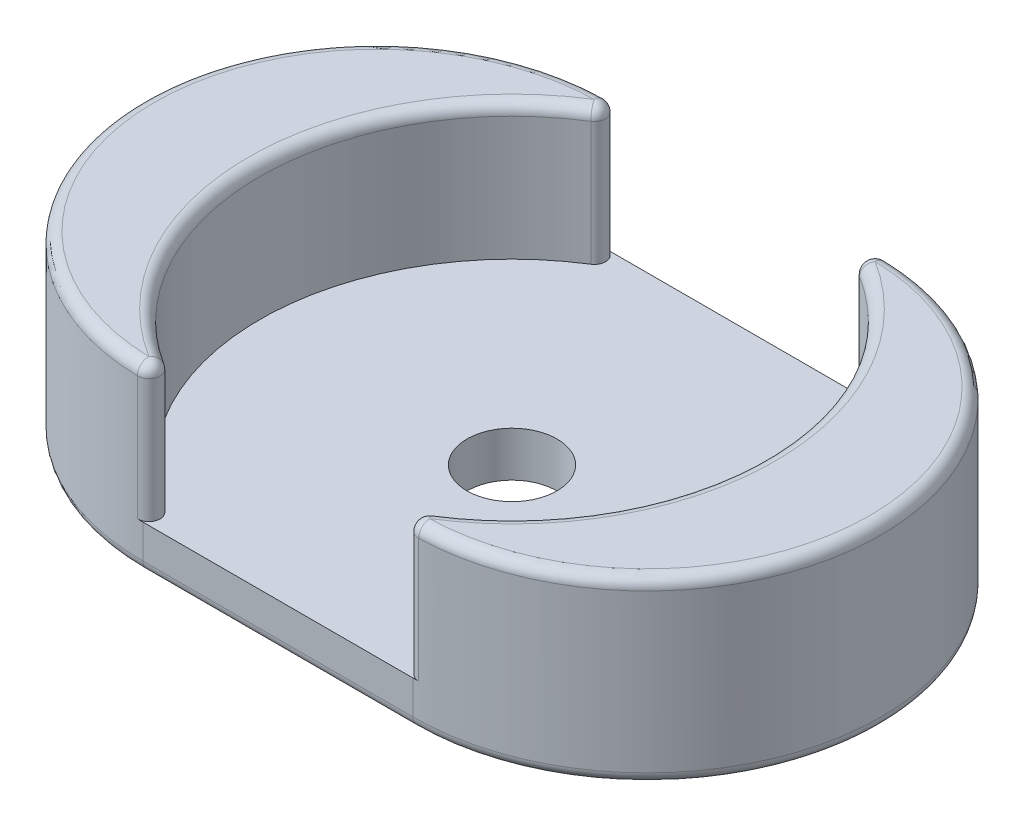
from build123d import *

# Parameters (mm, degrees)
BOSS_EXTRUDE1_DEPTH   = 2
BOSS_EXTRUDE1_2_DEPTH = 2
BOSS_EXTRUDE2_DEPTH   = 0.5
HOLE2_OUTLINE_R       = 0.5
HOLE2_DEPTH           = 0.5
FILLET2_R             = 0.125
FILLET3_R             = 0.125


# Read off the part's stored shape, not the designer's step: Hole2
with BuildPart() as part:
    # Sketch1 → Boss-Extrude1 (new body)
    with BuildSketch(Plane(origin=(0, 0, 0), x_dir=(1, 0, 0), z_dir=(0, 1, 0))):
        with BuildLine():
            Line((-1.0392304845412224, 2.6), (-1.5, 2.6))
            ThreePointArc((-1.5, 2.6), (-4.1, -1.7e-16), (-1.4999999999999993, -2.6))
            Line((-1.5, -2.6), (-1.039230484541227, -2.6))
            ThreePointArc((-1.0392304845412341, -2.6000000000000365), (-2.8, 2.83e-15), (-1.0392304845412292, 2.6000000000000387))
        make_face()
    extrude(amount=BOSS_EXTRUDE1_DEPTH)



with BuildPart() as body_2:
    # Sketch1 → Boss-Extrude1 2 (new body)
    with BuildSketch(Plane(origin=(0, 0, 0), x_dir=(1, 0, 0), z_dir=(0, 1, 0))):
        with BuildLine():
            Line((1.4999999999999991, 2.6000000000000005), (1.039230484541188, 2.6000000000000005))
            ThreePointArc((1.0392304845411973, 2.6000000000000516), (2.8000000000000003, 3.11e-15), (1.039230484541203, -2.6000000000000494))
            Line((1.0392304845411937, -2.5999999999999996), (1.5000000000000009, -2.5999999999999996))
            ThreePointArc((1.5000000000000009, -2.5999999999999996), (4.1, 1.73e-15), (1.4999999999999984, 2.6000000000000005))
        make_face()
    extrude(amount=BOSS_EXTRUDE1_2_DEPTH)


with BuildPart() as part_1:
    add(part.part)

    add(body_2.part)  # Boss-Extrude2 merges body 2
    # Sketch1<3> → Boss-Extrude2 (add)
    with BuildSketch(Plane(origin=(0, 0, 0), x_dir=(1, 0, 0), z_dir=(0, 1, 0))):
        with BuildLine():
            Line((1.0392304845411884, 2.6000000000000005), (-1.0392304845412224, 2.6))
            ThreePointArc((-1.0392304845412292, 2.6000000000000387), (-2.8, 2.83e-15), (-1.0392304845412341, -2.6000000000000365))
            Line((-1.039230484541227, -2.6), (1.0392304845411937, -2.5999999999999996))
            ThreePointArc((1.039230484541203, -2.600000000000049), (2.3183879481997147, -1.5700564708450193), (2.8, -6.9e-16))
            ThreePointArc((2.8, 0), (2.318387948199713, 1.5700564708450213), (1.0392304845411973, 2.6000000000000516))
        make_face()
    extrude(amount=BOSS_EXTRUDE2_DEPTH)

    # Hole2 outline → Hole2 (cut)
    with BuildSketch(Plane(origin=(0, 0, 0), x_dir=(1, 0, 0), z_dir=(0, 1, 0))):
        Circle(HOLE2_OUTLINE_R)
    extrude(amount=HOLE2_DEPTH, mode=Mode.SUBTRACT)

    # Fillet2
    # the kernel refuses this fillet: 0.125 mm, written as the material it takes off along each edge
    with BuildSketch(Plane(origin=(1.4999999999999987, 0, -2.6000000000000005), x_dir=(0, 1, 3.55e-15), z_dir=(-1, 0, 1.5e-16))) as fillet2_piece_1:
        with BuildLine():
            CenterArc((FILLET2_R, -FILLET2_R), FILLET2_R, 90.00000000000021, 89.99999999999979)
            Line((4.3e-16, -FILLET2_R), (0, 0))
            Line((0, 0), (FILLET2_R, 0))
        make_face()
    extrude(amount=2.9999999999999987, mode=Mode.SUBTRACT)
    with BuildSketch(Plane(origin=(1.4999999999999996, 0, -3.3e-16), x_dir=(5.1e-16, 0, 1), z_dir=(-1, 0, 5.1e-16))) as fillet2_piece_2:
        with BuildLine():
            CenterArc((2.6 - FILLET2_R, FILLET2_R), FILLET2_R, 270, 90)
            Line((2.6, FILLET2_R), (2.6, 0))
            Line((2.6, 0), (2.6 - FILLET2_R, 0))
        make_face()
    revolve(axis=Axis((1.4999999999999996, 0, -3.3e-16), (0, 1, 0)), revolution_arc=180, mode=Mode.SUBTRACT)
    with BuildSketch(Plane(origin=(1.5000000000000009, 0, 2.5999999999999996), x_dir=(-1.5e-16, 0, -1), z_dir=(-1, 0, 1.5e-16))) as fillet2_piece_3:
        with BuildLine():
            CenterArc((FILLET2_R, -FILLET2_R), FILLET2_R, 90, 90)
            Line((0, -FILLET2_R), (0, 0))
            Line((0, 0), (FILLET2_R, 0))
        make_face()
    extrude(amount=3.0000000000000004, mode=Mode.SUBTRACT)
    with BuildSketch(Plane(origin=(-1.0392304845412306, 0.5, 2.6000000000000183), x_dir=(-0.8909362232588717, 0, -0.4541284466813525), z_dir=(0, 1, 0))) as fillet2_piece_4:
        with BuildLine():
            CenterArc((0.5210688048998693, 0.1244811743822189), FILLET2_R, 115.6197462863135, 149.1581720450634)
            Line((0.4670192388207316, 0.23719161935808136), (0.46161428221281786, 0.24846266385566762))
            ThreePointArc((0.46161428221281786, 0.24846266385566762), (0.404839646312147, 0.2203852471241299), (-0.00567660558351699, 0.01113670279073605))
            Line((-0.00567660558351699, 0.01113670279073605), (0.00113770481419139, -0.01244811743822212))
            ThreePointArc((0.00113770481419139, -0.01244811743822212), (0.254845878378973, -0.00087830616170155), (0.5085540519437544, -0.0124481174382219))
            Line((0.5085540519437544, -0.0124481174382219), (0.5096917567579465, -1e-17))
        make_face()
    extrude(amount=2.809500939581575, mode=Mode.SUBTRACT)
    with BuildSketch(Plane(origin=(1.0392304845411986, 0.5, 2.600000000000024), x_dir=(0.8909362232588801, 0, -0.45412844668133606), z_dir=(0, 1, 0))) as fillet2_piece_5:
        with BuildLine():
            CenterArc((0.5210688048999061, -0.12448117438221841), FILLET2_R, 95.22208166862436, 149.158172045063)
            Line((0.4670192388207701, -0.23719161935808164), (0.46161428221285655, -0.248462663855668))
            ThreePointArc((0.46161428221285655, -0.248462663855668), (0.4048396463121838, -0.22038524712413216), (-0.00567660558351678, -0.01113670279073616))
            Line((-0.00567660558351678, -0.01113670279073616), (0.00113770481419136, 0.01244811743822204))
            ThreePointArc((0.00113770481419136, 0.01244811743822204), (0.2548458783789898, 0.00087830616169669), (0.5085540519437883, 0.0124481174382219))
            Line((0.5085540519437883, 0.0124481174382219), (0.5096917567579807, 2e-17))
        make_face()
    extrude(amount=2.8095009395816612, mode=Mode.SUBTRACT)
    with BuildSketch(Plane(origin=(1.0392304845411924, 0.5, -2.600000000000026), x_dir=(0.9999989359619427, 0, 0.001458792302720678), z_dir=(0, 1, 0))) as fillet2_piece_6:
        with BuildLine():
            CenterArc((0.5209523714738641, -0.12496755127300935), FILLET2_R, 88.69445799122111, 149.1581720450468)
            Line((0.45444002573679215, -0.23080283775418345), (0.447788791163085, -0.24138636640230085))
            ThreePointArc((0.447788791163085, -0.24138636640230085), (0.22682229100640774, -0.11618451467849848), (-0.00462248445880959, -0.01161389845952106))
            Line((-0.00462248445880959, -0.01161389845952106), (-1.823490378401e-05, 0.01249998669952446))
            ThreePointArc((-1.823490378401e-05, 0.01249998669952446), (0.46075079027872196, 0.01317215372197879), (0.5240851762685466, 0.01249675512730089))
            Line((0.5240851762685466, 0.01249675512730089), (0.5238003758326663, 0))
        make_face()
    extrude(amount=2.8095009395816657, mode=Mode.SUBTRACT)
    with BuildSketch(Plane(origin=(-1.4999999999999996, 0, 0), x_dir=(-1.7e-16, 0, -1), z_dir=(1, 0, -1.7e-16))) as fillet2_piece_7:
        with BuildLine():
            CenterArc((2.6 - FILLET2_R, FILLET2_R), FILLET2_R, 270, 90)
            Line((2.6 - FILLET2_R, -1e-17), (2.6, 0))
            Line((2.6, 0), (2.6, FILLET2_R))
        make_face()
    revolve(axis=Axis((-1.4999999999999996, 0, 0), (0, 1, 0)), revolution_arc=180, mode=Mode.SUBTRACT)
    with BuildSketch(Plane(origin=(-1.0392304845412257, 0.5, -2.600000000000019), x_dir=(-0.9999989359619427, 0, 0.0014587923027088937), z_dir=(0, 1, 0))) as fillet2_piece_8:
        with BuildLine():
            CenterArc((0.5209523714738317, 0.1249675512730093), FILLET2_R, 122.14736996373313, 149.15817204504657)
            Line((0.4544400257367579, 0.23080283775418217), (0.44778879116305065, 0.24138636640229952))
            ThreePointArc((0.44778879116305065, 0.24138636640229952), (0.2268222910063884, 0.11618451467850208), (-0.00462248445880995, 0.01161389845952101))
            Line((-0.00462248445880995, 0.01161389845952101), (-1.823490378386e-05, -0.01249998669952446))
            ThreePointArc((-1.823490378386e-05, -0.01249998669952446), (0.46075079027869037, -0.01317215372197953), (0.524085176268516, -0.01249675512730089))
            Line((0.524085176268516, -0.01249675512730089), (0.5238003758326356, 0))
        make_face()
    extrude(amount=2.809500939581589, mode=Mode.SUBTRACT)

    # Fillet3
    fillet3_edges = [part_1.edges().sort_by_distance(p)[0] for p in [
        (4.1, 2, 5.853e-14),
        (-2.799999999999999, 2, -1.78e-15),
        (-4.1, 2, 6.033e-14),
        (-1.440341394717322, 2, -2.510422560661599),
        (-1.4403413947172043, 2, 2.5104225606616026),
        (2.8, 2, -2.2e-16),
        (1.4403413947173214, 2, -2.5104225606615973),
        (1.4403413947172052, 2, 2.510422560661605),
    ]]
    fillet(fillet3_edges, radius=FILLET3_R)


solid = part_1.part
